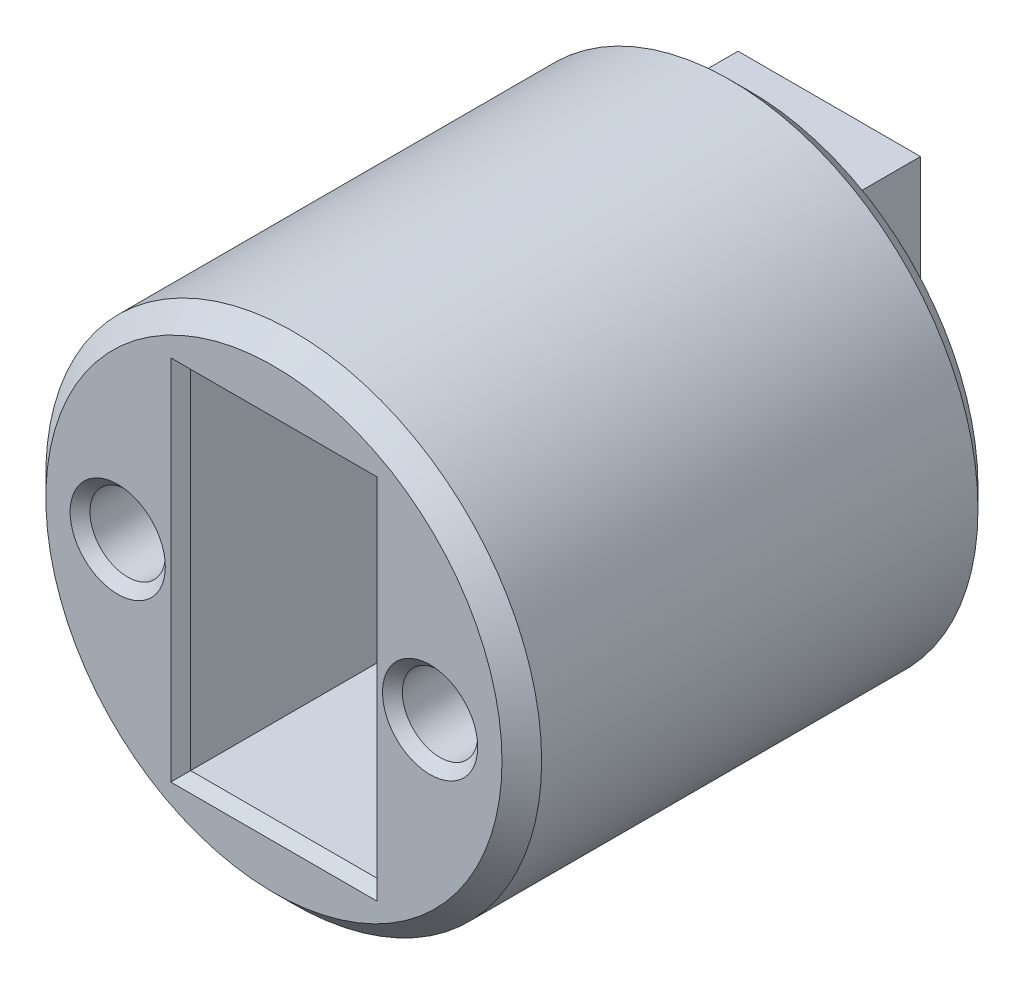
from build123d import *

# Parameters (mm, degrees)
CROQUIS1_R              = 12.5
SALIENTE_EXTRUIR1_DEPTH = 24
CROQUIS2_W              = 9.4
CROQUIS2_H              = 17.525
CORTAR_EXTRUIR1_DEPTH   = 18
CROQUIS3_W              = 9.2
CROQUIS3_H              = 17.9
SALIENTE_EXTRUIR2_DEPTH = 5
CHAFL_N1_SIZE           = 1
CHAFL_N2_SIZE           = 1
CROQUIS4_R              = 1.9
CORTAR_EXTRUIR2_DEPTH   = 34.963215395
CHAFL_N3_SIZE           = 1
CROQUIS5_W              = 6
CROQUIS5_H              = 14
CORTAR_EXTRUIR3_DEPTH   = 26.228951623
CHAFL_N4_SIZE           = 1.7
CHAFL_N5_SIZE           = 0.5
CHAFL_N6_SIZE           = 0.5


with BuildPart() as part:
    # Croquis1 → Saliente-Extruir1 (new body)
    with BuildSketch(Plane.XY):
        Circle(CROQUIS1_R)
    extrude(amount=SALIENTE_EXTRUIR1_DEPTH)

    # Croquis2 → Cortar-Extruir1 (cut)
    with BuildSketch(Plane.XY.offset(24)):
        Rectangle(CROQUIS2_W, CROQUIS2_H)
    extrude(amount=-CORTAR_EXTRUIR1_DEPTH, mode=Mode.SUBTRACT)

    # Croquis3 → Saliente-Extruir2 (add)
    with BuildSketch(Plane(origin=(0, 0, 0), x_dir=(-1, 0, 0), z_dir=(0, 0, -1))):
        Rectangle(CROQUIS3_W, CROQUIS3_H)
    extrude(amount=SALIENTE_EXTRUIR2_DEPTH)

    # Chaflán1
    chafl_n1_edges = [part.edges().sort_by_distance(p)[0] for p in [
        (-4.6, 0, -5),
        (0, 8.95, -5),
        (4.6, 0, -5),
        (0, -8.95, -5),
    ]]
    chamfer(chafl_n1_edges, length=CHAFL_N1_SIZE)

    # Chaflán2
    chafl_n2_edges = [part.edges().sort_by_distance(p)[0] for p in [
        (-12.5, 0, 0),
    ]]
    chamfer(chafl_n2_edges, length=CHAFL_N2_SIZE)

    # Croquis4 → Cortar-Extruir2 (cut, through all)
    with BuildSketch(Plane.XY.offset(24)):
        with Locations((-7.875, 0)):
            Circle(CROQUIS4_R)
        with Locations((7.875, 0)):
            Circle(CROQUIS4_R)
    extrude(amount=-CORTAR_EXTRUIR2_DEPTH, mode=Mode.SUBTRACT)

    # Chaflán3
    chafl_n3_edges = [part.edges().sort_by_distance(p)[0] for p in [
        (-12.5, 0, 24),
    ]]
    chamfer(chafl_n3_edges, length=CHAFL_N3_SIZE)

    # Croquis5 → Cortar-Extruir3 (cut, through all)
    with BuildSketch(Plane.XY.offset(6)):
        Rectangle(CROQUIS5_W, CROQUIS5_H)
    extrude(amount=-CORTAR_EXTRUIR3_DEPTH, mode=Mode.SUBTRACT)

    # Chaflán4
    chafl_n4_edges = [part.edges().sort_by_distance(p)[0] for p in [
        (4.7, 0, 6),
        (0, -8.7625, 6),
        (-4.7, 0, 6),
        (0, 8.7625, 6),
    ]]
    chamfer(chafl_n4_edges, length=CHAFL_N4_SIZE - 0.0001)  # a hair under: the kernel refuses the full size

    # Chaflán5
    chafl_n5_edges = [part.edges().sort_by_distance(p)[0] for p in [
        (-9.775, 0, 24),
        (5.975, 0, 24),
    ]]
    chamfer(chafl_n5_edges, length=CHAFL_N5_SIZE)

    # Chaflán6
    chafl_n6_edges = [part.edges().sort_by_distance(p)[0] for p in [
        (0, -8.7625, 24),
        (4.7, 0, 24),
        (0, 8.7625, 24),
        (-4.7, 0, 24),
    ]]
    chamfer(chafl_n6_edges, length=CHAFL_N6_SIZE)


solid = part.part
